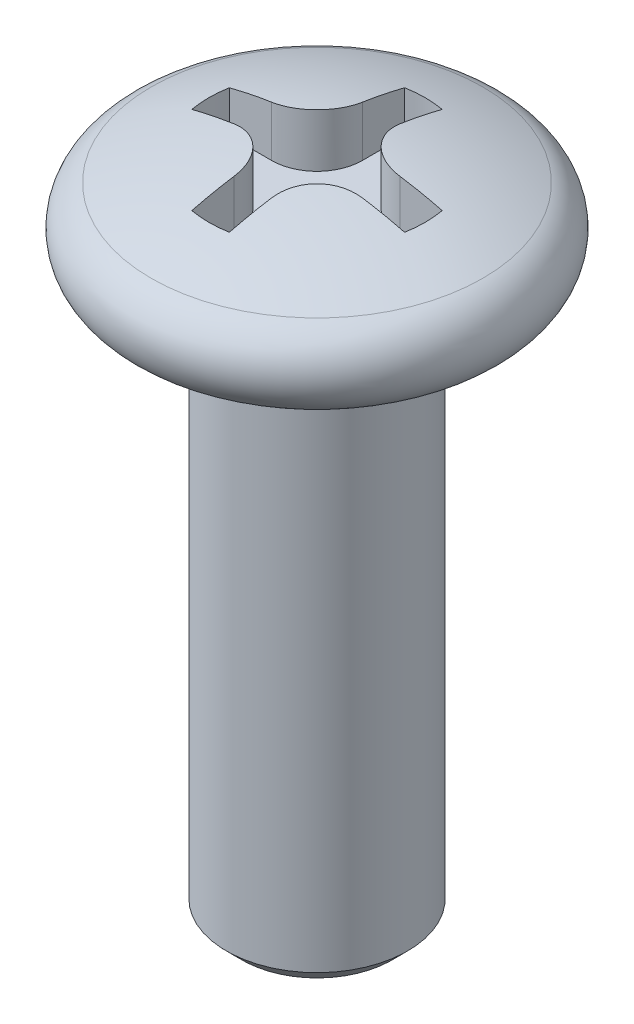
from build123d import *

# Parameters (mm, degrees)
CUT_EXTRUDE1_REACH = 11.621
CHAMFER1_SIZE      = 0.225
FILLET1_R          = 0.65


with BuildPart() as part:
    # Boss-Extrude1: read off the stored shape, not the designer's step
    # Boss-Extrude1 outline → Boss-Extrude1 (revolve)
    with BuildSketch(Plane.XY):
        with BuildLine():
            ThreePointArc((2.378097174, 1.12), (1.213027841, 1.478802074), (0, 1.6))
            Line((0, 1.6), (0, -8))
            Line((0, -8), (1.3, -8))
            Line((1.3, -8), (1.3, 0))
            Line((1.3, 0), (2.378097174, 0))
            ThreePointArc((2.378097174, 0), (2.75, 0.56), (2.378097174, 1.12))
        make_face()
    revolve(axis=Axis((0, 0, 0), (0, 1, 0)))

    # Sketch2 → Cut-Extrude1 (cut, up to next)
    with BuildSketch(Plane.XZ.offset(-0.8), mode=Mode.PRIVATE) as cut_extrude1_sk1:
        with BuildLine():
            Line((-0.269238816, 1.526437179), (-0.269238816, 0.269238816))
            Line((-0.269238816, 0.269238816), (-1.526437179, 0.269238816))
            ThreePointArc((-1.526437179, 0.269238816), (-1.55, 0), (-1.526437179, -0.269238816))
            Line((-1.526437179, -0.269238816), (-0.269238816, -0.269238816))
            Line((-0.269238816, -0.269238816), (-0.269238816, -1.526437179))
            ThreePointArc((-0.269238816, -1.526437179), (0, -1.55), (0.269238816, -1.526437179))
            Line((0.269238816, -1.526437179), (0.269238816, -0.269238816))
            Line((0.269238816, -0.269238816), (1.526437179, -0.269238816))
            ThreePointArc((1.526437179, -0.269238816), (1.55, 0), (1.526437179, 0.269238816))
            Line((1.526437179, 0.269238816), (0.269238816, 0.269238816))
            Line((0.269238816, 0.269238816), (0.269238816, 1.526437179))
            ThreePointArc((0.269238816, 1.526437179), (0, 1.55), (-0.269238816, 1.526437179))
        make_face()
    cut_extrude1_tool1 = extrude(cut_extrude1_sk1.sketch, amount=-CUT_EXTRUDE1_REACH, mode=Mode.PRIVATE) & part.part
    add(cut_extrude1_tool1.solids().sort_by_distance((0, 0.8, 0))[0], mode=Mode.SUBTRACT)

    # Chamfer1
    chamfer1_edges = [part.edges().sort_by_distance(p)[0] for p in [
        (-1.3, -8, 0),
    ]]
    chamfer(chamfer1_edges, length=CHAMFER1_SIZE)

    # Fillet1
    fillet1_edges = [part.edges().sort_by_distance(p)[0] for p in [
        (-0.269238816, 1.194082552, 0.269238816),
        (0.269238816, 1.194082552, 0.269238816),
        (-0.269238816, 1.194082552, -0.269238816),
        (0.269238816, 1.194082552, -0.269238816),
    ]]
    fillet(fillet1_edges, radius=FILLET1_R)


solid = part.part
